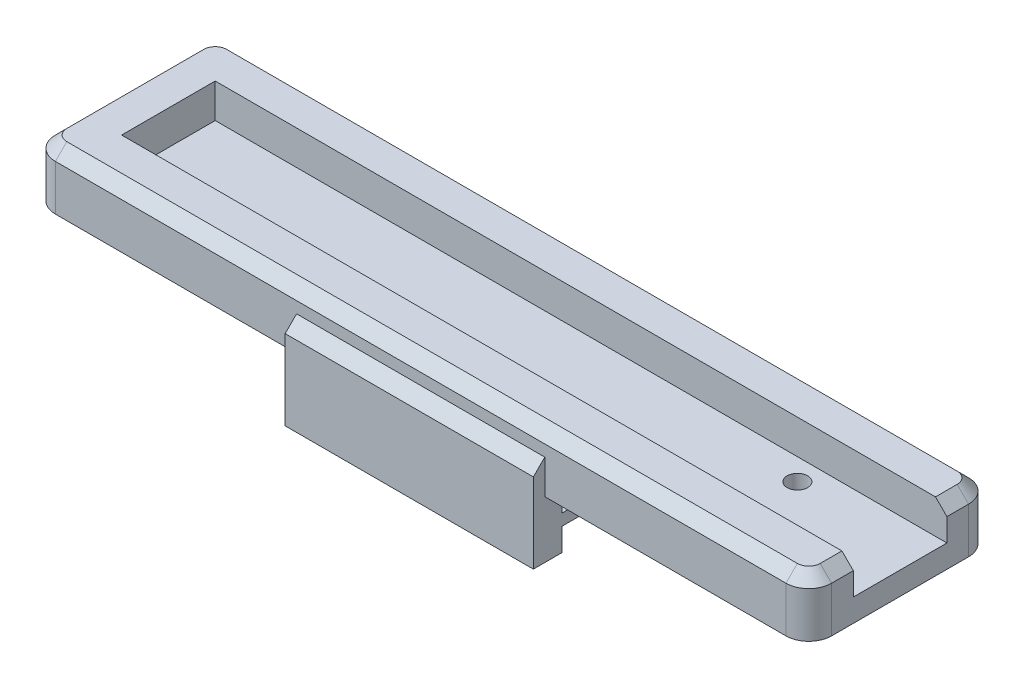
from build123d import *

# Parameters (mm, degrees)
SKETCH2_W           = 68
SKETCH2_H           = 16
BOSS_EXTRUDE1_DEPTH = 2
SKETCH3_W           = 68
SKETCH3_H           = 16
SKETCH3_W_2         = 60.2
SKETCH3_H_2         = 8.2
BOSS_EXTRUDE2_DEPTH = 3
SKETCH4_R           = 0.9
CUT_EXTRUDE1_DEPTH  = 36.057096286
SKETCH5_W           = 21.74313044
SKETCH5_H           = 18
BOSS_EXTRUDE3_DEPTH = 5
SKETCH6_W           = 13
SKETCH6_H           = 5
CUT_EXTRUDE3_DEPTH  = 21.743130441
SKETCH7_W           = 1.5
SKETCH7_H           = 1
BOSS_EXTRUDE4_DEPTH = 21.743130441
CHAMFER1_SIZE       = 3
SKETCH8_W           = 3.9
SKETCH8_H           = 8.2
CUT_EXTRUDE4_DEPTH  = 3
FILLET1_R           = 2
CHAMFER2_SIZE       = 1


with BuildPart() as part:
    # Sketch2 → Boss-Extrude1 (new body)
    with BuildSketch(Plane(origin=(0, 0, 0), x_dir=(1, 0, 0), z_dir=(0, 1, 0))):
        Rectangle(SKETCH2_W, SKETCH2_H)
    extrude(amount=BOSS_EXTRUDE1_DEPTH)

    # Sketch3 → Boss-Extrude2 (add)
    with BuildSketch(Plane(origin=(0, 2, 0), x_dir=(1, 0, 0), z_dir=(0, 1, 0))):
        Rectangle(SKETCH3_W, SKETCH3_H)
        Rectangle(SKETCH3_W_2, SKETCH3_H_2, mode=Mode.SUBTRACT)
    extrude(amount=BOSS_EXTRUDE2_DEPTH)

    # Sketch4 → Cut-Extrude1 (cut, through all)
    with BuildSketch(Plane(origin=(0, 2, 0), x_dir=(1, 0, 0), z_dir=(0, 1, 0))):
        with Locations(Location((-24.8, -2.2, 0), (0, 0, 270))):
            Circle(SKETCH4_R)
        with Locations(Location((22.8, 2.2, 0), (0, 0, 270))):
            Circle(SKETCH4_R)
    extrude(amount=-CUT_EXTRUDE1_DEPTH, mode=Mode.SUBTRACT)

    # Sketch5 → Boss-Extrude3 (add)
    with BuildSketch(Plane.XZ):
        Rectangle(SKETCH5_W, SKETCH5_H)
    extrude(amount=BOSS_EXTRUDE3_DEPTH)

    # Sketch6 → Cut-Extrude3 (cut)
    with BuildSketch(Plane.ZY.offset(10.87156522)):
        with Locations((0, -2.5)):
            Rectangle(SKETCH6_W, SKETCH6_H)
    extrude(amount=-CUT_EXTRUDE3_DEPTH, mode=Mode.SUBTRACT)

    # Sketch7 → Boss-Extrude4 (add)
    with BuildSketch(Plane.ZY.offset(10.87156522)):
        with Locations((-5.75, -2.5)):
            Rectangle(SKETCH7_W, SKETCH7_H)
        with Locations((5.75, -2.5)):
            Rectangle(SKETCH7_W, SKETCH7_H)
    extrude(amount=-BOSS_EXTRUDE4_DEPTH)

    # Chamfer1
    # the kernel refuses this chamfer: 3 mm, written as the material it adds along each edge
    with BuildSketch(Plane(origin=(10.87156522, 0, 8), x_dir=(0, 0.9996219169112968, -0.02749587661058649), z_dir=(-1, 0, 0))) as chamfer1_piece_1_section:
        Polygon((CHAMFER1_SIZE * 0.999621916911, -CHAMFER1_SIZE * 0.0274958766106), (-CHAMFER1_SIZE * 0.0274958766106, -CHAMFER1_SIZE * 0.999621916911), (0, 0), align=None)
    chamfer1_piece_1 = extrude(amount=21.743130441, mode=Mode.PRIVATE)
    chamfer1_piece_1 = split(chamfer1_piece_1, bisect_by=Plane(origin=(0, 1.266666667, 9), z_dir=(0, 0, -1)), keep=Keep.TOP, mode=Mode.PRIVATE)
    add(chamfer1_piece_1)
    with BuildSketch(Plane(origin=(-10.87156522, 0, -8), x_dir=(0, 0.9996219169112968, 0.02749587661058649), z_dir=(1, 0, 0))) as chamfer1_piece_2_section:
        Polygon((CHAMFER1_SIZE * 0.999621916911, -CHAMFER1_SIZE * 0.0274958766106), (-CHAMFER1_SIZE * 0.0274958766106, -CHAMFER1_SIZE * 0.999621916911), (0, 0), align=None)
    chamfer1_piece_2 = extrude(amount=21.743130441, mode=Mode.PRIVATE)
    chamfer1_piece_2 = split(chamfer1_piece_2, bisect_by=Plane(origin=(0, 1.266666667, -9), z_dir=(0, 0, 1)), keep=Keep.TOP, mode=Mode.PRIVATE)
    add(chamfer1_piece_2)

    # Sketch8 → Cut-Extrude4 (cut)
    with BuildSketch(Plane(origin=(0, 5, 0), x_dir=(1, 0, 0), z_dir=(0, 1, 0))):
        with Locations((32.05, 0)):
            Rectangle(SKETCH8_W, SKETCH8_H)
    extrude(amount=-CUT_EXTRUDE4_DEPTH, mode=Mode.SUBTRACT)

    # Fillet1
    fillet1_edges = [part.edges().sort_by_distance(p)[0] for p in [
        (34, 2.5, 8),
        (-34, 2.5, 8),
        (-34, 2.5, -8),
        (34, 2.5, -8),
    ]]
    fillet(fillet1_edges, radius=FILLET1_R)

    # Chamfer2
    chamfer2_edges = [part.edges().sort_by_distance(p)[0] for p in [
        (34, 5, -5.05),
        (34, 5, 5.05),
        (0, 5, 8),
        (0, 5, -8),
        (-34, 5, 0),
        (-33.414213562, 5, 7.414213562),
        (-33.414213562, 5, -7.414213562),
        (33.414213562, 5, -7.414213562),
        (33.414213562, 5, 7.414213562),
    ]]
    chamfer(chamfer2_edges, length=CHAMFER2_SIZE)


solid = part.part
